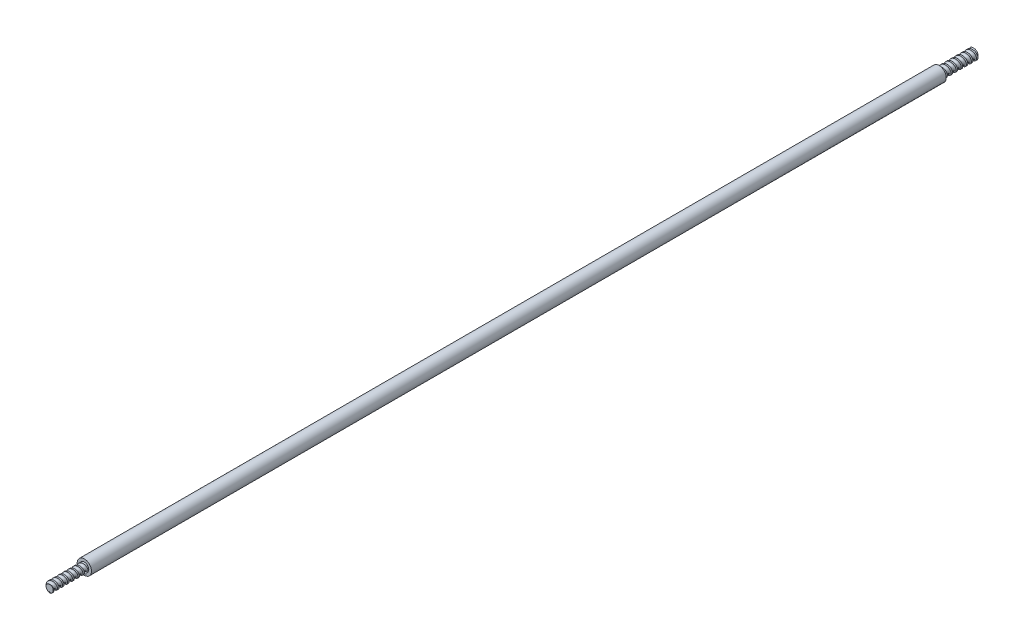
from build123d import *

# Parameters (mm, degrees)
SKETCH1_R           = 1.27
BOSS_EXTRUDE1_DEPTH = 152.146
SKETCH2_R           = 0.786134081
BOSS_EXTRUDE2_DEPTH = 6.35
SKETCH3_R           = 0.894844956
BOSS_EXTRUDE3_DEPTH = 6.35
CUT_SWEEP1_PITCH    = 0.907142857
CUT_SWEEP2_PITCH    = 0.907142857


with BuildPart() as part:
    # Sketch1 → Boss-Extrude1 (new body)
    with BuildSketch(Plane.XY):
        Circle(SKETCH1_R)
    extrude(amount=-BOSS_EXTRUDE1_DEPTH)

    # Sketch2 → Boss-Extrude2 (add)
    with BuildSketch(Plane.XY):
        Circle(SKETCH2_R)
    extrude(amount=BOSS_EXTRUDE2_DEPTH)

    # Sketch3 → Boss-Extrude3 (add)
    with BuildSketch(Plane(origin=(0, 0, -152.146), x_dir=(-1, 0, 0), z_dir=(0, 0, -1))):
        Circle(SKETCH3_R)
    extrude(amount=BOSS_EXTRUDE3_DEPTH)

    # Cut-Sweep1: arcs per turn and ends read off the stored shape
    # Cut-Sweep1: the profile of Cut-Sweep1 profile screwed along a right-hand helix through 8 turns, 8 arcs to a turn; built about Z, then put on its axis
    cut_sweep1_z = Axis((0, 0, 0), (0, 0, 1))
    cut_sweep1_corners = [(0.783110745, 0.057564971, -1.219380786), (0.465610745, 0, -0.907142857), (0.783110745, -0.057564971, -0.594904928), (1.100610745, 0, -0.907142857)]
    with BuildLine(mode=Mode.PRIVATE) as cut_sweep1_profile:
        ThreePointArc((0.783110745, 0.057564971, -1.219380786), (0.558604342, 0.040704581, -1.127928414), (0.465610745, 0, -0.907142857))
        ThreePointArc((0.465610745, 0, -0.907142857), (0.558604342, -0.040704581, -0.6863573), (0.783110745, -0.057564971, -0.594904928))
        ThreePointArc((0.783110745, -0.057564971, -0.594904928), (1.007617148, -0.040704581, -0.6863573), (1.100610745, 0, -0.907142857))
        ThreePointArc((1.100610745, 0, -0.907142857), (1.007617148, 0.040704581, -1.127928414), (0.783110745, 0.057564971, -1.219380786))
    cut_sweep1_cap = Face(cut_sweep1_profile.wire())
    cut_sweep1_arcs = [((0.783110745, 0.057564971, -1.219380786), (0.465610745, 0.057564971, -1.219380786), (0.465610745, 0, -0.907142857), (1, 0.7071067811865476, 1)), ((0.465610745, 0, -0.907142857), (0.465610745, -0.057564971, -0.594904928), (0.783110745, -0.057564971, -0.594904928), (1, 0.7071067811865476, 1)), ((0.783110745, -0.057564971, -0.594904928), (1.100610745, -0.057564971, -0.594904928), (1.100610745, 0, -0.907142857), (1, 0.7071067811865476, 1)), ((1.100610745, 0, -0.907142857), (1.100610745, 0.057564971, -1.219380786), (0.783110745, 0.057564971, -1.219380786), (1, 0.7071067811865476, 1))]  # start, shoulder, end, weights
    cut_sweep1_turn_angles = [0, 22.5, 45, 67.5, 90, 112.5, 135, 157.5, 180, 202.5, 225, 247.5, 270, 292.5, 315, 337.5, 360]
    cut_sweep1_turn_weights = [1, 0.9238795325112867, 1, 0.9238795325112867, 1, 0.9238795325112867, 1, 0.9238795325112867, 1, 0.9238795325112867, 1, 0.9238795325112867, 1, 0.9238795325112867, 1, 0.9238795325112867, 1]
    cut_sweep1_turn_sides = [Face.make_bezier_surface([[Vector(p[j][0], p[j][1], 0).rotate(cut_sweep1_z, cut_sweep1_turn_angles[2 * i + k]) / cut_sweep1_turn_weights[2 * i + k] + Vector(0, 0, p[j][2] + CUT_SWEEP1_PITCH * cut_sweep1_turn_angles[2 * i + k] / 360) for k in range(3)] for j in range(3)], [[p[3][j] * cut_sweep1_turn_weights[2 * i + k] for k in range(3)] for j in range(3)]) for p in cut_sweep1_arcs for i in range(8)]
    cut_sweep1 = Plane(origin=(0, 0, 6.35), x_dir=(-1, 0, 0), z_dir=(0, 0, -1)) * Solid(Shell([*[p.moved(Location((0, 0, CUT_SWEEP1_PITCH * i))) for i in range(8) for p in cut_sweep1_turn_sides], cut_sweep1_cap, cut_sweep1_cap.rotate(cut_sweep1_z, 2880).moved(Location((0, 0, CUT_SWEEP1_PITCH * 2880 / 360)))]))
    add(cut_sweep1, mode=Mode.SUBTRACT)

    # Cut-Sweep2: arcs per turn and ends read off the stored shape
    # Cut-Sweep2: the profile of Cut-Sweep2 profile screwed along a right-hand helix through 8 turns, 8 arcs to a turn; built about Z, then put on its axis
    cut_sweep2_z = Axis((0, 0, 0), (0, 0, 1))
    cut_sweep2_corners = [(0.887082228, -0.051003331, -0.59376623), (1.204582228, 0, -0.907142857), (0.887082228, 0.051003331, -1.220519484), (0.569582228, 0, -0.907142857)]
    with BuildLine(mode=Mode.PRIVATE) as cut_sweep2_profile:
        ThreePointArc((0.887082228, -0.051003331, -0.59376623), (1.111588631, -0.036064801, -0.685552119), (1.204582228, 0, -0.907142857))
        ThreePointArc((1.204582228, 0, -0.907142857), (1.111588631, 0.036064801, -1.128733595), (0.887082228, 0.051003331, -1.220519484))
        ThreePointArc((0.887082228, 0.051003331, -1.220519484), (0.662575825, 0.036064801, -1.128733595), (0.569582228, 0, -0.907142857))
        ThreePointArc((0.569582228, 0, -0.907142857), (0.662575825, -0.036064801, -0.685552119), (0.887082228, -0.051003331, -0.59376623))
    cut_sweep2_cap = Face(cut_sweep2_profile.wire())
    cut_sweep2_arcs = [((0.887082228, -0.051003331, -0.59376623), (1.204582228, -0.051003331, -0.59376623), (1.204582228, 0, -0.907142857), (1, 0.7071067811865476, 1)), ((1.204582228, 0, -0.907142857), (1.204582228, 0.051003331, -1.220519484), (0.887082228, 0.051003331, -1.220519484), (1, 0.7071067811865476, 1)), ((0.887082228, 0.051003331, -1.220519484), (0.569582228, 0.051003331, -1.220519484), (0.569582228, 0, -0.907142857), (1, 0.7071067811865476, 1)), ((0.569582228, 0, -0.907142857), (0.569582228, -0.051003331, -0.59376623), (0.887082228, -0.051003331, -0.59376623), (1, 0.7071067811865476, 1))]  # start, shoulder, end, weights
    cut_sweep2_turn_angles = [0, 22.5, 45, 67.5, 90, 112.5, 135, 157.5, 180, 202.5, 225, 247.5, 270, 292.5, 315, 337.5, 360]
    cut_sweep2_turn_weights = [1, 0.9238795325112867, 1, 0.9238795325112867, 1, 0.9238795325112867, 1, 0.9238795325112867, 1, 0.9238795325112867, 1, 0.9238795325112867, 1, 0.9238795325112867, 1, 0.9238795325112867, 1]
    cut_sweep2_turn_sides = [Face.make_bezier_surface([[Vector(p[j][0], p[j][1], 0).rotate(cut_sweep2_z, cut_sweep2_turn_angles[2 * i + k]) / cut_sweep2_turn_weights[2 * i + k] + Vector(0, 0, p[j][2] + CUT_SWEEP2_PITCH * cut_sweep2_turn_angles[2 * i + k] / 360) for k in range(3)] for j in range(3)], [[p[3][j] * cut_sweep2_turn_weights[2 * i + k] for k in range(3)] for j in range(3)]) for p in cut_sweep2_arcs for i in range(8)]
    cut_sweep2 = Plane(origin=(0, 0, -158.496), x_dir=(1, 0, 0), z_dir=(0, 0, 1)) * Solid(Shell([*[p.moved(Location((0, 0, CUT_SWEEP2_PITCH * i))) for i in range(8) for p in cut_sweep2_turn_sides], cut_sweep2_cap, cut_sweep2_cap.rotate(cut_sweep2_z, 2880).moved(Location((0, 0, CUT_SWEEP2_PITCH * 2880 / 360)))]))
    add(cut_sweep2, mode=Mode.SUBTRACT)


solid = part.part
